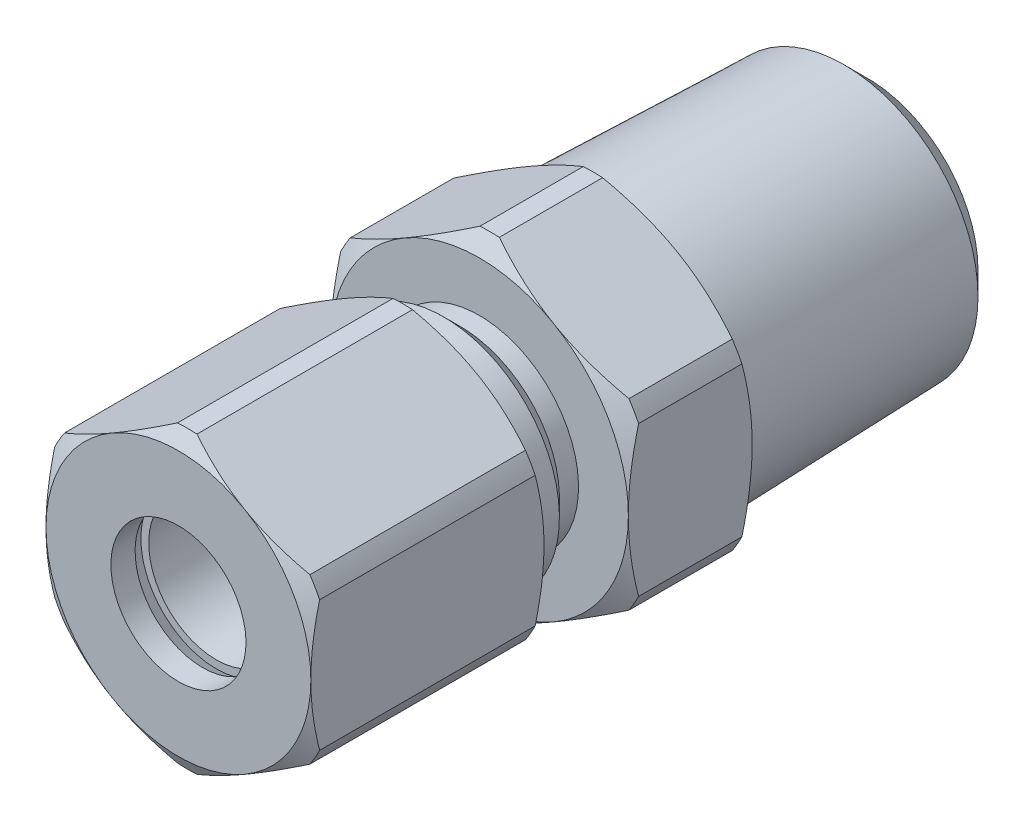
from build123d import *

# Parameters (mm, degrees)
BOSS_EXTRUDE1_DEPTH  = 26.924
SKETCH3_W            = 8.334375
SKETCH3_H            = 2.692641971
BOSS_EXTRUDEX1_DEPTH = 11.176
SKETCH13_OUTSIDE_W   = 54.368
SKETCH13_OUTSIDE_H   = 56.07
SKETCH13_OUTSIDE_R   = 5.318470859
CUT_EXTRUDE1_DEPTH   = 15.10284
CUT_EXTRUDE1_DRAFT   = -45


# Read off the part's stored shape, not the designer's step: Split1
with BuildPart() as part:
    # Sketch2 → Boss-Extrude1 (new body)
    with BuildSketch(Plane.XY.offset(10.414)):
        Polygon((0, 8.248891971), (-7.14375, 4.124445986), (-7.14375, -4.124445986), (0, -8.248891971), (7.14375, -4.124445986), (7.14375, 4.124445986), align=None)
    extrude(amount=-BOSS_EXTRUDE1_DEPTH)

    # Sketch3 → Cut-Revolve1 (revolve, cut)
    with BuildSketch(Plane(origin=(0, 0, 0), x_dir=(0, 0, -1), z_dir=(1, 0, 0)), mode=Mode.PRIVATE) as cut_revolve1_sk:
        with Locations((-6.2468125, 6.902570986)):
            Rectangle(SKETCH3_W, SKETCH3_H)
        Polygon((3.85572, 6.781763856), (3.85572, 8.248891971), (16.51, 8.248891971), (16.51, 6.38777167), align=None)
    revolve(cut_revolve1_sk.sketch.rotate(Axis((0, 0, 16.51), (0, 0, -1)), 180), axis=Axis((0, 0, 16.51), (0, 0, -1)), mode=Mode.SUBTRACT)

    # Sketch6 → Cut-Revolve2 (revolve, cut)
    with BuildSketch(Plane(origin=(0, 0, 0), x_dir=(0, 0, -1), z_dir=(1, 0, 0)), mode=Mode.PRIVATE) as cut_revolve2_sk:
        Polygon((-2.079625, 5.670817944), (-3.912712105, 5.670817944), (-2.996168552, 4.754274392), (-2.079625, 4.754274392), align=None)
        Polygon((-10.414, 5.670817944), (-10.414, 4.754274392), (-9.497456448, 5.670817944), align=None)
    revolve(cut_revolve2_sk.sketch.rotate(Axis((0, 0, 16.51), (0, 0, -1)), 180), axis=Axis((0, 0, 16.51), (0, 0, -1)), mode=Mode.SUBTRACT)

    # Sketch7 → Cut-Revolve3 (revolve, cut)
    with BuildSketch(Plane(origin=(0, 0, 0), x_dir=(0, 0, -1), z_dir=(1, 0, 0)), mode=Mode.PRIVATE) as cut_revolve3_sk:
        Polygon((-2.079625, 8.248891971), (-2.079625, 7.14375), (-1.588217954, 7.994891971), (3.364312954, 7.994891971), (3.85572, 7.14375), (3.85572, 8.248891971), align=None)
        Polygon((-8.346841981, 3.2385), (-3.556, 3.2385), (-3.556, 2.3876), (16.51, 2.3876), (16.51, 0), (-9.652, 0), (-14.696841981, 0), (-14.696841981, 4.3688), (-9.652, 4.3688), (-8.346841981, 3.615266667), align=None)
    revolve(cut_revolve3_sk.sketch.rotate(Axis((0, 0, 16.51), (0, 0, -1)), 180), axis=Axis((0, 0, 16.51), (0, 0, -1)), mode=Mode.SUBTRACT)


with BuildPart() as body_2:
    # Sketch8 → Revolve1 (revolve)
    with BuildSketch(Plane(origin=(0, 0, 0), x_dir=(0, 0, -1), z_dir=(1, 0, 0)), mode=Mode.PRIVATE) as revolve1_sk:
        Polygon((-14.696841981, 3.2385), (-14.696841981, 3.615266667), (-13.391683963, 4.3688), (-9.652, 4.3688), (-8.346841981, 3.615266667), (-8.346841981, 3.2385), align=None)
    revolve(revolve1_sk.sketch.rotate(Axis((0, 0, 16.51), (0, 0, -1)), 180), axis=Axis((0, 0, 16.51), (0, 0, -1)))


with BuildPart() as body_3:
    # Sketch9 → Boss-Extrudex1 (new body)
    with BuildSketch(Plane.XY.offset(16.51)):
        Polygon((0, 7.332348419), (-6.35, 3.666174209), (-6.35, -3.666174209), (0, -7.332348419), (6.35, -3.666174209), (6.35, 3.666174209), align=None)
    extrude(amount=-BOSS_EXTRUDEX1_DEPTH)

    # Sketch10 → Cut-Revolve4 (revolve, cut)
    with BuildSketch(Plane(origin=(0, 0, 0), x_dir=(0, 0, -1), z_dir=(1, 0, 0)), mode=Mode.PRIVATE) as cut_revolve4_sk:
        Polygon((-16.51, 0), (-5.334, 0), (-5.334, 5.55625), (-5.334, 5.670817944), (-5.448567944, 5.55625), (-11.334960231, 5.55625), (-15.349420991, 3.2385), (-16.51, 3.2385), align=None)
        Polygon((-5.334, 7.332348419), (-5.334, 6.35), (-5.754512156, 7.078348419), (-16.089487844, 7.078348419), (-16.51, 6.35), (-16.51, 7.332348419), align=None)
    revolve(cut_revolve4_sk.sketch.rotate(Axis((0, 0, 16.51), (0, 0, -1)), 180), axis=Axis((0, 0, 16.51), (0, 0, -1)), mode=Mode.SUBTRACT)


with BuildPart() as body_4:
    # Split1: the piece on the far side of the plane
    add(part.part)
    split(bisect_by=Plane.XY.offset(-3.85572), keep=Keep.BOTTOM)


with BuildPart() as part_1:
    add(part.part)

    # Split1
    split(bisect_by=Plane.XY.offset(-3.85572), keep=Keep.TOP)


with BuildPart() as cut_extrude1_tool:
    # Sketch13 outside → Cut-Extrude1 (with draft: the straight prism first)
    with BuildSketch(Plane(origin=(0, 0, -16.51), x_dir=(-1, 0, 0), z_dir=(0, 0, -1))):
        Rectangle(SKETCH13_OUTSIDE_W, SKETCH13_OUTSIDE_H)
        Circle(SKETCH13_OUTSIDE_R, mode=Mode.SUBTRACT)
    extrude(amount=-CUT_EXTRUDE1_DEPTH)
    # Cut-Extrude1: the draft: its side faces are tilted about the plane it starts from
    cut_extrude1_sides = [cut_extrude1_tool.faces().sort_by_distance(p)[0] for p in [
        (0, -28.035, -8.95858),
        (-27.184, 0, -8.95858),
        (0, 28.035, -8.95858),
        (27.184, 0, -8.95858),
        (5.318470859, 0, -8.95858),
    ]]
    draft(cut_extrude1_sides, Plane(origin=(0, 0, -16.51), x_dir=(-1, 0, 0), z_dir=(0, 0, -1)), CUT_EXTRUDE1_DRAFT)


with BuildPart() as body_4_1:
    add(body_4.part)

    # Cut-Extrude1: cut by cut_extrude1_tool
    add(cut_extrude1_tool.part, mode=Mode.SUBTRACT)


with BuildPart() as part_2:
    add(part_1.part)

    # Combine1: union body 4
    add(body_4_1.part)


solid = Compound([body_2.part, body_3.part, part_2.part])
